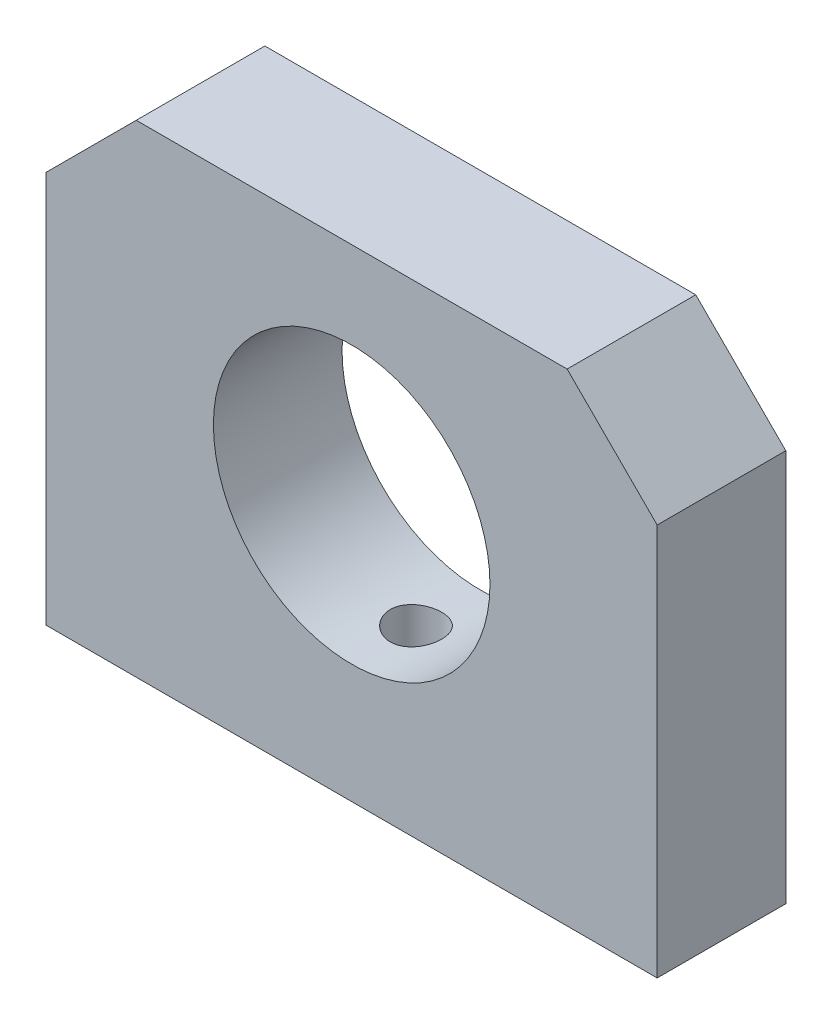
from build123d import *

# Parameters (mm, degrees)
SCHIZZO1_R                   = 21.5
ESTRUSIONE_ESTRUSIONE1_DEPTH = 20
SCHIZZO2_R                   = 4
TAGLIO_ESTRUSIONE1_DEPTH     = 20


with BuildPart() as part:
    # Schizzo1 → Estrusione-Estrusione1 (new body)
    with BuildSketch(Plane.XY):
        Polygon((0, 0), (95, 0), (95, 61), (81, 75), (14, 75), (0, 61), align=None)
        with Locations((47.5, 40)):
            Circle(SCHIZZO1_R, mode=Mode.SUBTRACT)
    extrude(amount=ESTRUSIONE_ESTRUSIONE1_DEPTH)

    # Schizzo2 → Taglio-Estrusione1 (cut)
    with BuildSketch(Plane.XZ):
        with Locations((47.5, 10)):
            Circle(SCHIZZO2_R)
        with Locations((15.889854058, 10)):
            Circle(SCHIZZO2_R)
        with Locations((79.110145942, 10)):
            Circle(SCHIZZO2_R)
    extrude(amount=-TAGLIO_ESTRUSIONE1_DEPTH, mode=Mode.SUBTRACT)


solid = part.part
